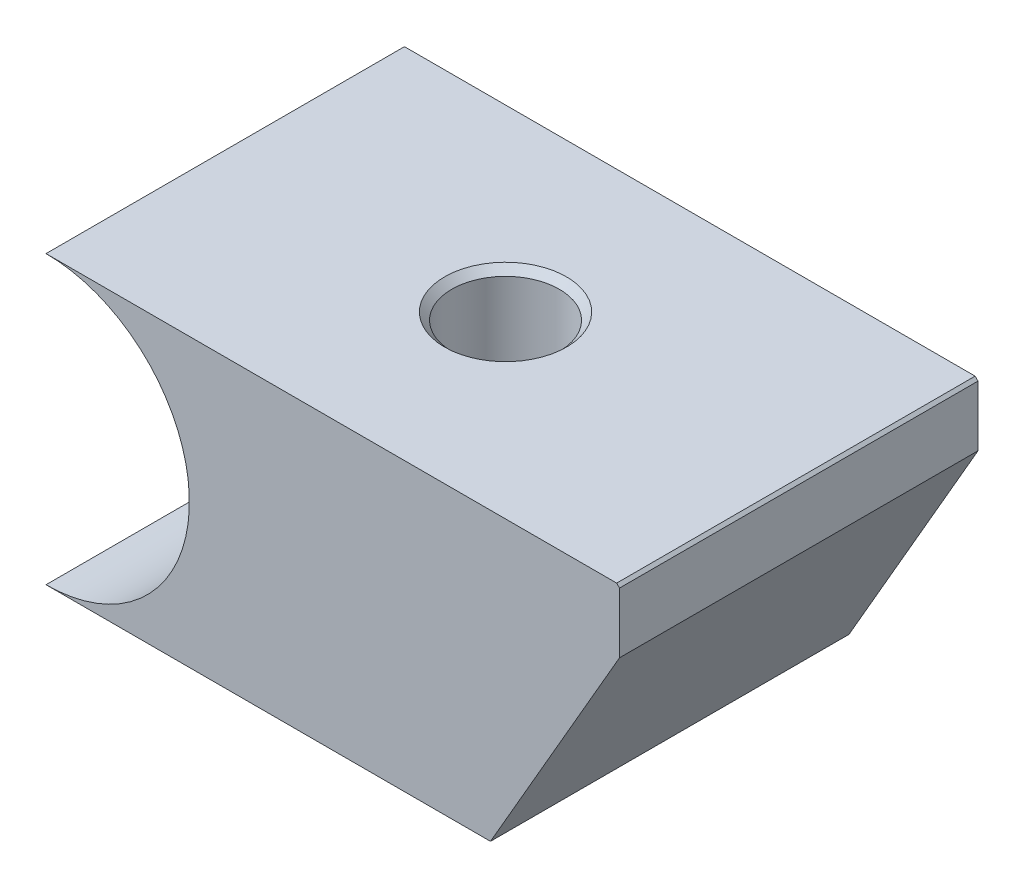
from build123d import *

# Parameters (mm, degrees)
BOSS_EXTRUDE1_DEPTH                    = 31.75
CHAMFER1_SIZE                          = 11.43
CHAMFER1_SIZE2                         = 19.797340731
F_3_8_0_375_DIAMETER_HOLE1_D           = 9.525
F_3_8_0_375_DIAMETER_HOLE1_CSINK_D     = 10.795
F_3_8_0_375_DIAMETER_HOLE1_CSINK_ANGLE = 90
CHAMFER2_SIZE                          = 0.254


with BuildPart() as part:
    # Sketch1 → Boss-Extrude1 (new body)
    with BuildSketch(Plane.XY):
        with BuildLine():
            Line((0, 0), (50.8, 0))
            Line((50.8, 0), (50.8, 25.4))
            Line((50.8, 25.4), (0, 25.4))
            ThreePointArc((0, 25.4), (12.7, 12.7), (0, 0))
        make_face()
    extrude(amount=BOSS_EXTRUDE1_DEPTH)

    # Chamfer1
    chamfer1_edges = [part.edges().sort_by_distance(p)[0] for p in [
        (50.8, 0, 15.875),
    ]]
    chamfer1_side = [part.faces().sort_by_distance(p)[0] for p in [
        (25.4, 0, 15.875),
    ]]
    chamfer(chamfer1_edges, length=CHAMFER1_SIZE, length2=CHAMFER1_SIZE2, reference=chamfer1_side[0])

    # 3/8 (0.375) Diameter Hole1 (through all)
    with Locations(Plane(origin=(0, 25.4, 0), x_dir=(1, 0, 0), z_dir=(0, 1, 0))):
        with Locations((24.8285, -15.875)):
            CounterSinkHole(F_3_8_0_375_DIAMETER_HOLE1_D / 2, F_3_8_0_375_DIAMETER_HOLE1_CSINK_D / 2, counter_sink_angle=F_3_8_0_375_DIAMETER_HOLE1_CSINK_ANGLE)

    # Chamfer2
    chamfer2_edges = [part.edges().sort_by_distance(p)[0] for p in [
        (50.8, 25.4, 15.875),
    ]]
    chamfer(chamfer2_edges, length=CHAMFER2_SIZE)


solid = part.part
